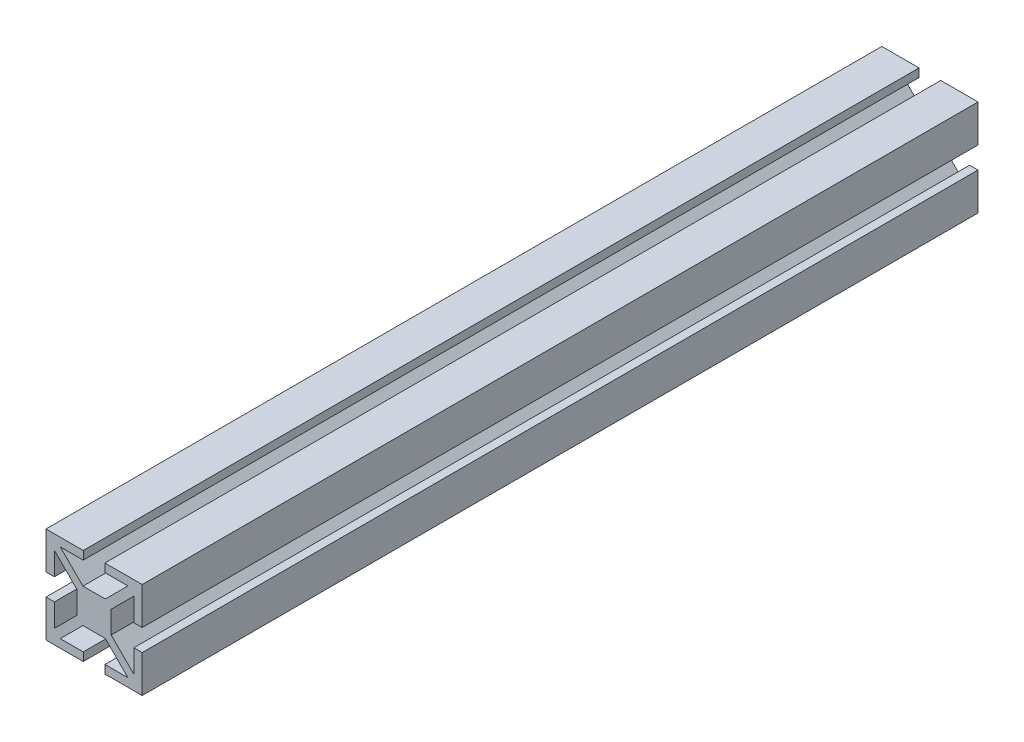
from build123d import *

# Parameters (mm, degrees)
EXTRUDE1_DEPTH = 220.6752


# Read off the part's stored shape, not the designer's step: 1010<1>
with BuildPart() as part:
    # Sketch1<2> → Extrude1 (new body)
    with BuildSketch(Plane.XY):
        Polygon((10.030020765, -6.992412451), (19.865235782, -6.992412451), (19.865235782, -9.202212451), (13.80238533, -9.202212451), (19.78408533, -15.183912451), (25.6759562, -15.183912451), (31.6576562, -9.202212451), (25.594805747, -9.202212451), (25.594805747, -6.992412451), (35.430020765, -6.992412451), (35.430020765, -16.827627469), (33.220220765, -16.827627469), (33.220220765, -10.764777016), (27.238520765, -16.746477016), (27.238520765, -22.638347886), (33.220220765, -28.620047886), (33.220220765, -22.557197434), (35.430020765, -22.557197434), (35.430020765, -32.392412451), (25.594805747, -32.392412451), (25.594805747, -30.182612451), (31.6576562, -30.182612451), (25.6759562, -24.200912451), (19.78408533, -24.200912451), (13.80238533, -30.182612451), (19.865235782, -30.182612451), (19.865235782, -32.392412451), (10.030020765, -32.392412451), (10.030020765, -22.557197434), (12.239820765, -22.557197434), (12.239820765, -28.620047886), (18.221520765, -22.638347886), (18.221520765, -16.746477016), (12.239820765, -10.764777016), (12.239820765, -16.827627469), (10.030020765, -16.827627469), align=None)
    extrude(amount=EXTRUDE1_DEPTH)


solid = part.part
